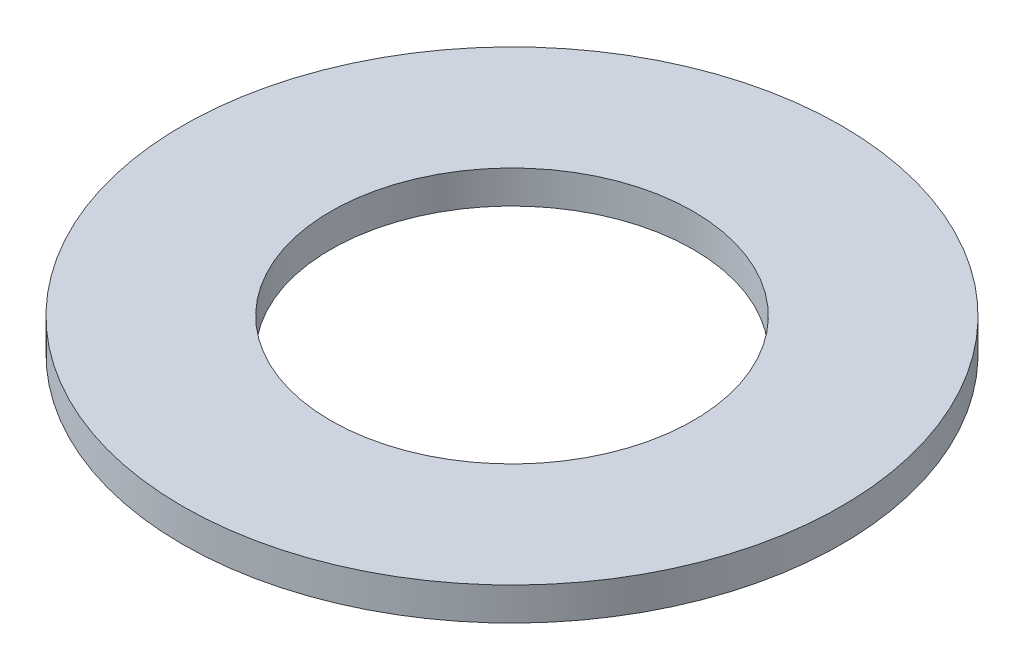
from build123d import *

# Parameters (mm, degrees)
SKIZZE1_R                       = 20
SKIZZE1_R_2                     = 11
AUFSATZ_LINEAR_AUSTRAGEN1_DEPTH = 2


with BuildPart() as part:
    # Skizze1 → Aufsatz-Linear austragen1 (new body)
    with BuildSketch(Plane(origin=(0, 0, 0), x_dir=(1, 0, 0), z_dir=(0, 1, 0))):
        Circle(SKIZZE1_R)
        Circle(SKIZZE1_R_2, mode=Mode.SUBTRACT)
    extrude(amount=AUFSATZ_LINEAR_AUSTRAGEN1_DEPTH)


solid = part.part
